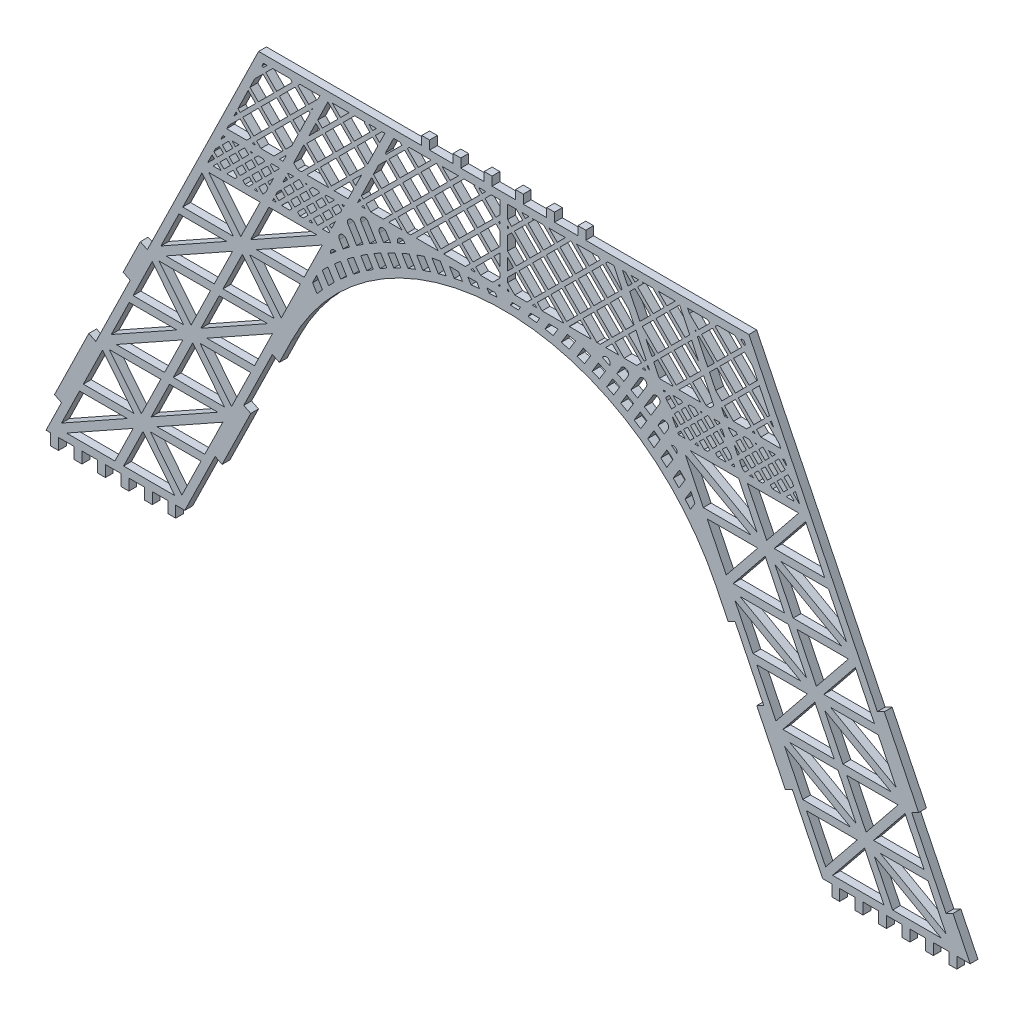
from build123d import *

# Parameters (mm, degrees)
BOSS_EXTRUDE1_DEPTH = 3


with BuildPart() as part:
    # Sketch1 → Boss-Extrude1 (new body)
    with BuildSketch(Plane.XY):
        with BuildLine():
            Line((89.934803369, 195.474198664), (92.629395714, 194.155421921))
            Line((92.629395714, 194.155421921), (97.353202661, 203.807346789))
            ThreePointArc((97.353202661, 203.807346789), (178.815734464, 254.633848748), (260.278266268, 203.807346789))
            Line((260.278266268, 203.807346789), (265.002073215, 194.155421922))
            Line((265.002073215, 194.155421922), (267.696665559, 195.474198664))
            Line((267.696665559, 195.474198664), (278.686471747, 173.019262459))
            Line((278.686471747, 173.019262459), (275.991879402, 171.700485717))
            Line((275.991879402, 171.700485717), (286.98168559, 149.245549512))
            Line((286.98168559, 149.245549512), (289.676277934, 150.564326255))
            Line((289.676277934, 150.564326255), (301.311514626, 126.790613307))
            Line((301.311514626, 126.790613307), (304.815734464, 126.790613307))
            Line((304.815734464, 126.790613307), (304.815734464, 122.449462056))
            Line((304.815734464, 122.449462056), (307.815734464, 122.449462056))
            Line((307.815734464, 122.449462056), (307.815734464, 126.790613307))
            Line((307.815734464, 126.790613307), (313.815734464, 126.790613307))
            Line((313.815734464, 126.790613307), (313.815734464, 122.449462056))
            Line((313.815734464, 122.449462056), (316.815734464, 122.449462056))
            Line((316.815734464, 122.449462056), (316.815734464, 126.790613307))
            Line((316.815734464, 126.790613307), (322.815734464, 126.790613307))
            Line((322.815734464, 126.790613307), (322.815734464, 122.449462057))
            Line((322.815734464, 122.449462057), (325.815734464, 122.449462057))
            Line((325.815734464, 122.449462057), (325.815734464, 126.790613307))
            Line((325.815734464, 126.790613307), (331.815734464, 126.790613307))
            Line((331.815734464, 126.790613307), (331.815734464, 122.449462057))
            Line((331.815734464, 122.449462057), (334.815734464, 122.449462057))
            Line((334.815734464, 122.449462057), (334.815734464, 126.790613307))
            Line((334.815734464, 126.790613307), (340.815734464, 126.790613307))
            Line((340.815734464, 126.790613307), (340.815734464, 122.449462057))
            Line((340.815734464, 122.449462057), (343.815734464, 122.449462057))
            Line((343.815734464, 122.449462057), (343.815734464, 126.790613307))
            Line((343.815734464, 126.790613307), (349.815734464, 126.790613307))
            Line((349.815734464, 126.790613307), (349.815734464, 122.449462057))
            Line((349.815734464, 122.449462057), (352.815734464, 122.449462057))
            Line((352.815734464, 122.449462057), (352.815734464, 126.790613307))
            Line((352.815734464, 126.790613307), (357.971491777, 126.790613307))
            Line((357.971491777, 126.790613307), (351.377608065, 140.26357503))
            Line((351.377608065, 140.26357503), (348.68301572, 138.944798288))
            Line((348.68301572, 138.944798288), (335.495248295, 165.890721733))
            Line((335.495248295, 165.890721733), (338.18984064, 167.209498476))
            Line((338.18984064, 167.209498476), (325.002073215, 194.155421921))
            Line((325.002073215, 194.155421921), (322.30748087, 192.836645179))
            Line((322.30748087, 192.836645179), (272.975711615, 293.633848749))
            Line((272.975711615, 293.633848749), (210.315734464, 293.633848749))
            Line((210.315734464, 293.633848749), (210.315734464, 297))
            Line((210.315734464, 297), (207.315734464, 297))
            Line((207.315734464, 297), (207.315734464, 293.633848749))
            Line((207.315734464, 293.633848749), (198.315734464, 293.633848749))
            Line((198.315734464, 293.633848749), (198.315734464, 297))
            Line((198.315734464, 297), (195.315734464, 297))
            Line((195.315734464, 297), (195.315734464, 293.633848749))
            Line((195.315734464, 293.633848749), (186.315734464, 293.633848749))
            Line((186.315734464, 293.633848749), (186.315734464, 297))
            Line((186.315734464, 297), (183.315734464, 297))
            Line((183.315734464, 297), (183.315734464, 293.633848749))
            Line((183.315734464, 293.633848749), (174.315734464, 293.633848749))
            Line((174.315734464, 293.633848749), (174.315734464, 297))
            Line((174.315734464, 297), (171.315734464, 297))
            Line((171.315734464, 297), (171.315734464, 293.633848749))
            Line((171.315734464, 293.633848749), (162.315734464, 293.633848749))
            Line((162.315734464, 293.633848749), (162.315734464, 297))
            Line((162.315734464, 297), (159.315734464, 297))
            Line((159.315734464, 297), (159.315734464, 293.633848749))
            Line((159.315734464, 293.633848749), (150.315734464, 293.633848749))
            Line((150.315734464, 293.633848749), (150.315734464, 297))
            Line((150.315734464, 297), (147.315734464, 297))
            Line((147.315734464, 297), (147.315734464, 293.633848749))
            Line((147.315734464, 293.633848749), (84.655757313, 293.633848749))
            Line((84.655757313, 293.633848749), (41.917871771, 206.309606902))
            Line((41.917871771, 206.309606902), (39.223279426, 207.628383644))
            Line((39.223279426, 207.628383644), (32.629395714, 194.155421921))
            Line((32.629395714, 194.155421921), (35.323988058, 192.836645179))
            Line((35.323988058, 192.836645179), (22.136220633, 165.890721733))
            Line((22.136220633, 165.890721733), (19.441628289, 167.209498476))
            Line((19.441628289, 167.209498476), (6.253860864, 140.26357503))
            Line((6.253860864, 140.26357503), (8.948453208, 138.944798288))
            Line((8.948453208, 138.944798288), (3, 126.790613307))
            Line((3, 126.790613307), (4.815734464, 126.790613307))
            Line((4.815734464, 126.790613307), (4.815734464, 122.449462056))
            Line((4.815734464, 122.449462056), (7.815734464, 122.449462056))
            Line((7.815734464, 122.449462056), (7.815734464, 126.790613307))
            Line((7.815734464, 126.790613307), (13.815734464, 126.790613307))
            Line((13.815734464, 126.790613307), (13.815734464, 122.449462056))
            Line((13.815734464, 122.449462056), (16.815734464, 122.449462056))
            Line((16.815734464, 122.449462056), (16.815734464, 126.790613307))
            Line((16.815734464, 126.790613307), (22.815734464, 126.790613307))
            Line((22.815734464, 126.790613307), (22.815734464, 122.449462057))
            Line((22.815734464, 122.449462057), (25.815734464, 122.449462057))
            Line((25.815734464, 122.449462057), (25.815734464, 126.790613307))
            Line((25.815734464, 126.790613307), (31.815734464, 126.790613307))
            Line((31.815734464, 126.790613307), (31.815734464, 122.449462057))
            Line((31.815734464, 122.449462057), (34.815734464, 122.449462057))
            Line((34.815734464, 122.449462057), (34.815734464, 126.790613307))
            Line((34.815734464, 126.790613307), (40.815734464, 126.790613307))
            Line((40.815734464, 126.790613307), (40.815734464, 122.449462056))
            Line((40.815734464, 122.449462056), (43.815734464, 122.449462056))
            Line((43.815734464, 122.449462056), (43.815734464, 126.790613307))
            Line((43.815734464, 126.790613307), (49.815734464, 126.790613307))
            Line((49.815734464, 126.790613307), (49.815734464, 122.449462056))
            Line((49.815734464, 122.449462056), (52.815734464, 122.449462056))
            Line((52.815734464, 122.449462056), (52.815734464, 126.790613307))
            Line((52.815734464, 126.790613307), (56.319954302, 126.790613307))
            Line((56.319954302, 126.790613307), (67.955190994, 150.564326254))
            Line((67.955190994, 150.564326254), (70.649783339, 149.245549512))
            Line((70.649783339, 149.245549512), (81.639589526, 171.700485717))
            Line((81.639589526, 171.700485717), (78.944997182, 173.019262459))
            Line((78.944997182, 173.019262459), (89.934803369, 195.474198664))
        make_face()
        Polygon((29.458213877, 129.790613307), (10.877270476, 129.790613307), (36.477464972, 144.132707502), align=None, mode=Mode.SUBTRACT)
        Polygon((34.191261131, 146.290613307), (8.967635057, 132.159485469), (15.88363583, 146.290613307), align=None, mode=Mode.SUBTRACT)
        Polygon((40.249009391, 145.014414528), (52.521478324, 129.790613307), (32.798236726, 129.790613307), align=None, mode=Mode.SUBTRACT)
        Polygon((62.523544434, 146.290613307), (55.176022091, 131.277778444), (43.073620937, 146.290613307), align=None, mode=Mode.SUBTRACT)
        Polygon((17.351883981, 149.290613307), (24.699406324, 164.303448171), (36.801807479, 149.290613307), align=None, mode=Mode.SUBTRACT)
        Polygon((39.626419025, 150.566812087), (27.353950091, 165.790613307), (47.077191689, 165.790613307), align=None, mode=Mode.SUBTRACT)
        Polygon((70.907793358, 163.421741145), (63.991792585, 149.290613307), (45.684167284, 149.290613307), align=None, mode=Mode.SUBTRACT)
        Polygon((43.397963444, 151.448519112), (50.417214538, 165.790613307), (68.998157939, 165.790613307), align=None, mode=Mode.SUBTRACT)
        Polygon((55.564690934, 183.132707502), (48.54543984, 168.790613307), (29.964496439, 168.790613307), align=None, mode=Mode.SUBTRACT)
        Polygon((28.05486102, 171.159485469), (34.970861793, 185.290613307), (53.278487094, 185.290613307), align=None, mode=Mode.SUBTRACT)
        Polygon((59.336235353, 184.014414528), (71.608704287, 168.790613307), (51.885462689, 168.790613307), align=None, mode=Mode.SUBTRACT)
        Polygon((81.610770397, 185.290613307), (74.263248054, 170.277778444), (62.160846899, 185.290613307), align=None, mode=Mode.SUBTRACT)
        Polygon((36.439109944, 188.290613307), (43.786632287, 203.303448171), (55.889033441, 188.290613307), align=None, mode=Mode.SUBTRACT)
        Polygon((58.713644987, 189.566812087), (46.441176054, 204.790613307), (66.164417652, 204.790613307), align=None, mode=Mode.SUBTRACT)
        Polygon((89.995019321, 202.421741145), (83.079018548, 188.290613307), (64.771393247, 188.290613307), align=None, mode=Mode.SUBTRACT)
        Polygon((62.485189406, 190.448519112), (69.504440501, 204.790613307), (88.085383902, 204.790613307), align=None, mode=Mode.SUBTRACT)
        Polygon((295.107924494, 146.290613307), (314.557847992, 146.290613307), (302.455446837, 131.277778444), align=None, mode=Mode.SUBTRACT)
        Polygon((305.109990604, 129.790613307), (317.382459537, 145.014414528), (324.833232202, 129.790613307), align=None, mode=Mode.SUBTRACT)
        Polygon((328.173255051, 129.790613307), (321.154003957, 144.132707502), (346.754198452, 129.790613307), align=None, mode=Mode.SUBTRACT)
        Polygon((348.663833871, 132.159485469), (323.440207797, 146.290613307), (341.747833098, 146.290613307), align=None, mode=Mode.SUBTRACT)
        Polygon((311.947301644, 149.290613307), (293.639676343, 149.290613307), (286.72367557, 163.421741145), align=None, mode=Mode.SUBTRACT)
        Polygon((288.633310989, 165.790613307), (307.21425439, 165.790613307), (314.233505484, 151.448519112), align=None, mode=Mode.SUBTRACT)
        Polygon((310.554277239, 165.790613307), (330.277518837, 165.790613307), (318.005049904, 150.566812087), align=None, mode=Mode.SUBTRACT)
        Polygon((340.279584947, 149.290613307), (320.829661449, 149.290613307), (332.932062604, 164.303448171), align=None, mode=Mode.SUBTRACT)
        Polygon((305.746006239, 168.790613307), (286.022764641, 168.790613307), (298.295233575, 184.014414528), align=None, mode=Mode.SUBTRACT)
        Polygon((276.020698532, 185.290613307), (295.470622029, 185.290613307), (283.368220875, 170.277778444), align=None, mode=Mode.SUBTRACT)
        Polygon((327.666972489, 168.790613307), (309.086029088, 168.790613307), (302.066777994, 183.132707502), align=None, mode=Mode.SUBTRACT)
        Polygon((304.352981834, 185.290613307), (322.660607135, 185.290613307), (329.576607908, 171.159485469), align=None, mode=Mode.SUBTRACT)
        Polygon((292.860075681, 188.290613307), (274.552450381, 188.290613307), (267.636449608, 202.421741145), align=None, mode=Mode.SUBTRACT)
        Polygon((269.546085026, 204.790613307), (288.127028427, 204.790613307), (295.146279522, 190.448519112), align=None, mode=Mode.SUBTRACT)
        Polygon((291.467051277, 204.790613307), (311.190292875, 204.790613307), (298.917823941, 189.566812087), align=None, mode=Mode.SUBTRACT)
        Polygon((321.192358984, 188.290613307), (301.742435487, 188.290613307), (313.844836641, 203.303448171), align=None, mode=Mode.SUBTRACT)
        Polygon((74.651916897, 222.132707502), (67.632665803, 207.790613307), (49.051722401, 207.790613307), align=None, mode=Mode.SUBTRACT)
        Polygon((47.142086983, 210.159485469), (54.058087756, 224.290613307), (72.365713056, 224.290613307), align=None, mode=Mode.SUBTRACT)
        Polygon((78.423461316, 223.014414528), (90.69593025, 207.790613307), (70.972688652, 207.790613307), align=None, mode=Mode.SUBTRACT)
        Polygon((100.697996359, 224.290613307), (93.350474016, 209.277778444), (81.248072862, 224.290613307), align=None, mode=Mode.SUBTRACT)
        Polygon((55.526335907, 227.290613307), (62.87385825, 242.303448171), (74.976259404, 227.290613307), align=None, mode=Mode.SUBTRACT)
        Polygon((65.528402016, 243.790613307), (85.251643614, 243.790613307), (77.80087095, 228.566812087), align=None, mode=Mode.SUBTRACT)
        Polygon((68.75560906, 248.354953136), (70.319948888, 246.790613307), (67.191269232, 246.790613307), align=None, mode=Mode.SUBTRACT)
        Polygon((65.069948888, 246.790613307), (66.795077514, 250.315484681), (67.694948888, 249.415613307), align=None, mode=Mode.SUBTRACT)
        Polygon((68.75560906, 250.476273479), (67.492134742, 251.739747797), (68.068919069, 252.918263145), (69.642307011, 254.491651087), (71.206646839, 252.927311258), align=None, mode=Mode.SUBTRACT)
        Polygon((83.654004962, 247.503349038), (84.366740693, 246.790613307), (82.941269232, 246.790613307), align=None, mode=Mode.SUBTRACT)
        Polygon((90.497020142, 247.683729761), (91.355042742, 246.825707161), (91.319948888, 246.790613307), (90.059914614, 246.790613307), align=None, mode=Mode.SUBTRACT)
        Polygon((72.441269232, 246.790613307), (74.892307011, 249.241651087), (76.456646839, 247.677311258), (75.569948888, 246.790613307), align=None, mode=Mode.SUBTRACT)
        Polygon((71.38060906, 247.851273479), (69.816269232, 249.415613307), (72.267307011, 251.866651087), (73.831646839, 250.302311258), align=None, mode=Mode.SUBTRACT)
        Polygon((79.464665134, 246.790613307), (78.577967183, 247.677311258), (81.029004962, 250.128349038), (82.59334479, 248.56400921), (80.819948888, 246.790613307), align=None, mode=Mode.SUBTRACT)
        Polygon((77.517307011, 248.73797143), (75.952967183, 250.302311258), (78.404004962, 252.753349038), (79.96834479, 251.18900921), align=None, mode=Mode.SUBTRACT)
        Polygon((86.279004962, 246.999669381), (84.714665134, 248.56400921), (87.165702913, 251.015046989), (88.254515202, 249.9262347), (87.342889171, 248.06355359), align=None, mode=Mode.SUBTRACT)
        Polygon((83.654004962, 249.624669381), (82.089665134, 251.18900921), (84.540702913, 253.640046989), (86.105042742, 252.075707161), align=None, mode=Mode.SUBTRACT)
        Polygon((88.951572431, 251.350497815), (88.226363085, 252.075707161), (90.341859352, 254.191203428), align=None, mode=Mode.SUBTRACT)
        Polygon((109.169942966, 226.614619747), (107.104403072, 224.240392777), (105.388978946, 227.0509636), (106.953063328, 230.246781108), align=None, mode=Mode.SUBTRACT)
        Polygon((109.082245283, 241.421741145), (102.16624451, 227.290613307), (83.85861921, 227.290613307), align=None, mode=Mode.SUBTRACT)
        Polygon((88.591666463, 243.790613307), (107.172609864, 243.790613307), (81.572415369, 229.448519112), align=None, mode=Mode.SUBTRACT)
        with BuildLine():
            Line((109.11442913, 233.085371436), (109.106891433, 233.097857388))
            ThreePointArc((109.106891433, 233.097857388), (110.141695024, 234.125502772), (111.191646446, 235.137666553))
            ThreePointArc((111.191646446, 235.137666553), (111.46182883, 234.921073967), (111.675144578, 234.648297025))
            Line((111.675144578, 234.648297025), (113.708387044, 231.317008942))
            ThreePointArc((113.708387044, 231.317008942), (112.607582632, 230.235643757), (111.524736089, 229.136296505))
            Line((111.524736089, 229.136296505), (109.11442913, 233.085371436))
        make_face(mode=Mode.SUBTRACT)
        with BuildLine():
            ThreePointArc((112.257210706, 240.164956683), (112.720613468, 241.746527752), (114.356307346, 241.94805865))
            ThreePointArc((114.356307346, 241.94805865), (113.30069248, 241.063649303), (112.257210706, 240.164956683))
        make_face(mode=Mode.SUBTRACT)
        with BuildLine():
            Line((116.190521688, 233.630047872), (113.807748433, 237.534011262))
            ThreePointArc((113.807748433, 237.534011262), (114.954307556, 238.531095025), (116.116157689, 239.510318248))
            Line((116.116157689, 239.510318248), (118.486470352, 235.626770436))
            ThreePointArc((118.486470352, 235.626770436), (117.330390096, 234.63772982), (116.190521688, 233.630047872))
        make_face(mode=Mode.SUBTRACT)
        with BuildLine():
            Line((121.090642361, 237.739861929), (118.731183869, 241.605626142))
            ThreePointArc((118.731183869, 241.605626142), (119.930062446, 242.518477894), (121.142807561, 243.412825395))
            Line((121.142807561, 243.412825395), (123.495033669, 239.558910804))
            ThreePointArc((123.495033669, 239.558910804), (122.285520793, 238.65905816), (121.090642361, 237.739861929))
        make_face(mode=Mode.SUBTRACT)
        Polygon((104.689098816, 247.538442892), (105.4369284, 246.790613307), (103.941269232, 246.790613307), align=None, mode=Mode.SUBTRACT)
        Polygon((111.95645783, 247.29447978), (111.709857491, 246.790613307), (109.191269232, 246.790613307), (110.825796767, 248.425140843), align=None, mode=Mode.SUBTRACT)
        Polygon((93.511456939, 246.790613307), (93.476363085, 246.825707161), (95.927400865, 249.27674494), (97.491740693, 247.712405112), (96.569948888, 246.790613307), align=None, mode=Mode.SUBTRACT)
        Polygon((92.415702913, 247.886367333), (91.19407737, 249.107992876), (91.851089294, 250.45043337), (93.302400865, 251.90174494), (94.866740693, 250.337405112), align=None, mode=Mode.SUBTRACT)
        Polygon((100.534852841, 246.790613307), (99.613061036, 247.712405112), (102.064098816, 250.163442891), (103.628438644, 248.599103063), (101.819948888, 246.790613307), align=None, mode=Mode.SUBTRACT)
        Polygon((98.552400865, 248.773065284), (96.988061036, 250.337405112), (99.439098816, 252.788442891), (101.003438644, 251.224103063), align=None, mode=Mode.SUBTRACT)
        Polygon((107.314098816, 247.034763235), (105.749758988, 248.599103063), (108.200796767, 251.050140843), (109.765136595, 249.485801014), align=None, mode=Mode.SUBTRACT)
        Polygon((114.124029577, 251.723373652), (112.653515059, 248.718742895), (111.886456939, 249.485801014), align=None, mode=Mode.SUBTRACT)
        Polygon((104.689098816, 249.659763235), (103.124758988, 251.224103063), (105.575796767, 253.675140843), (107.140136595, 252.110801014), align=None, mode=Mode.SUBTRACT)
        Polygon((110.825796767, 250.546461186), (109.261456939, 252.110801014), (111.712494718, 254.561838794), (113.276834546, 252.997498966), align=None, mode=Mode.SUBTRACT)
        with BuildLine():
            Line((118.269028291, 248.121258748), (119.575045889, 245.981464337))
            ThreePointArc((119.575045889, 245.981464337), (118.36030564, 245.090509862), (117.158962841, 244.181571344))
            Line((117.158962841, 244.181571344), (115.708312843, 246.558333159))
            ThreePointArc((115.708312843, 246.558333159), (116.207207772, 248.620153677), (118.269028291, 248.121258748))
        make_face(mode=Mode.SUBTRACT)
        with BuildLine():
            Line((126.217922511, 241.477495259), (123.870949894, 245.322802469))
            ThreePointArc((123.870949894, 245.322802469), (125.121148086, 246.153006395), (126.383888087, 246.964006868))
            Line((126.383888087, 246.964006868), (128.728563185, 243.122463939))
            ThreePointArc((128.728563185, 243.122463939), (127.466655351, 242.310033796), (126.217922511, 241.477495259))
        make_face(mode=Mode.SUBTRACT)
        with BuildLine():
            Line((131.289278633, 244.685389528), (128.944603534, 248.526932457))
            ThreePointArc((128.944603534, 248.526932457), (130.243177174, 249.279222679), (131.553096237, 250.011579236))
            Line((131.553096237, 250.011579236), (133.900068854, 246.166272026))
            ThreePointArc((133.900068854, 246.166272026), (132.588743351, 245.436286037), (131.289278633, 244.685389528))
        make_face(mode=Mode.SUBTRACT)
        with BuildLine():
            Line((121.565970147, 254.857739609), (124.820785523, 249.525012273))
            ThreePointArc((124.820785523, 249.525012273), (123.557531244, 248.714893729), (122.306429365, 247.886131086))
            Line((122.306429365, 247.886131086), (119.005254699, 253.29481402))
            ThreePointArc((119.005254699, 253.29481402), (119.504149629, 255.356634539), (121.565970147, 254.857739609))
        make_face(mode=Mode.SUBTRACT)
        with BuildLine():
            Line((136.576921314, 247.57285624), (134.225299166, 251.425781295))
            ThreePointArc((134.225299166, 251.425781295), (135.572646249, 252.099524997), (136.930170337, 252.752520472))
            Line((136.930170337, 252.752520472), (139.288781012, 248.888145333))
            ThreePointArc((139.288781012, 248.888145333), (137.92756205, 248.241405866), (136.576921314, 247.57285624))
        make_face(mode=Mode.SUBTRACT)
        with BuildLine():
            Line((142.068094645, 250.126855969), (139.700010033, 254.006753317))
            ThreePointArc((139.700010033, 254.006753317), (141.09695852, 254.600641099), (142.502920391, 255.17286395))
            Line((142.502920391, 255.17286395), (144.882940562, 251.273411243))
            ThreePointArc((144.882940562, 251.273411243), (143.470868147, 250.711548237), (142.068094645, 250.126855969))
        make_face(mode=Mode.SUBTRACT)
        Polygon((72.267307011, 253.98797143), (70.702967183, 255.552311258), (73.154004962, 258.003349038), (74.71834479, 256.43900921), align=None, mode=Mode.SUBTRACT)
        Polygon((74.892307011, 251.36297143), (73.327967183, 252.927311258), (75.779004962, 255.378349038), (77.34334479, 253.81400921), align=None, mode=Mode.SUBTRACT)
        Polygon((71.819948888, 258.790613307), (70.102293257, 257.072957677), (70.942941492, 258.790613307), align=None, mode=Mode.SUBTRACT)
        Polygon((78.404004962, 254.874669381), (76.839665134, 256.43900921), (79.191269232, 258.790613307), (79.390136595, 258.790613307), (80.855042742, 257.325707161), align=None, mode=Mode.SUBTRACT)
        Polygon((75.779004962, 257.499669381), (74.488061036, 258.790613307), (77.069948888, 258.790613307), align=None, mode=Mode.SUBTRACT)
        Polygon((81.029004962, 252.249669381), (79.464665134, 253.81400921), (81.915702913, 256.265046989), (83.480042742, 254.700707161), align=None, mode=Mode.SUBTRACT)
        Polygon((87.165702913, 253.136367333), (85.601363085, 254.700707161), (88.052400865, 257.15174494), (89.616740693, 255.587405112), align=None, mode=Mode.SUBTRACT)
        Polygon((84.540702913, 255.761367333), (82.976363085, 257.325707161), (84.441269232, 258.790613307), (86.413532498, 258.790613307), (86.991740693, 258.212405112), align=None, mode=Mode.SUBTRACT)
        Polygon((81.915702913, 258.386367333), (81.511456939, 258.790613307), (82.319948888, 258.790613307), align=None, mode=Mode.SUBTRACT)
        Polygon((90.677400865, 256.648065284), (89.113061036, 258.212405112), (89.691269232, 258.790613307), (92.592884369, 258.790613307), (92.37523354, 258.345897959), align=None, mode=Mode.SUBTRACT)
        Polygon((82.802400865, 262.40174494), (83.413532498, 261.790613307), (82.191269232, 261.790613307), align=None, mode=Mode.SUBTRACT)
        Polygon((77.552400865, 267.65174494), (81.741740693, 263.462405112), (80.069948888, 261.790613307), (72.411189643, 261.790613307), (73.101263439, 263.200607514), align=None, mode=Mode.SUBTRACT)
        Polygon((75.134637627, 267.355302046), (76.026514711, 269.177631093), (76.491740693, 268.712405112), align=None, mode=Mode.SUBTRACT)
        Polygon((83.863061036, 263.462405112), (89.825796767, 269.425140843), (94.015136595, 265.235801014), (90.569948888, 261.790613307), (85.534852841, 261.790613307), align=None, mode=Mode.SUBTRACT)
        Polygon((82.802400865, 264.523065284), (78.613061036, 268.712405112), (84.575796767, 274.675140843), (88.765136595, 270.485801014), align=None, mode=Mode.SUBTRACT)
        Polygon((77.552400865, 269.773065284), (76.72357194, 270.601894209), (80.64223331, 278.608704299), (83.515136595, 275.735801014), align=None, mode=Mode.SUBTRACT)
        Polygon((89.825796767, 271.546461186), (85.636456939, 275.735801014), (91.599192669, 281.698536745), (95.788532498, 277.509196917), align=None, mode=Mode.SUBTRACT)
        Polygon((84.575796767, 276.796461186), (81.339290539, 280.032967415), (83.165952177, 283.765296253), (86.349192669, 286.948536745), (90.538532498, 282.759196917), align=None, mode=Mode.SUBTRACT)
        Polygon((85.199326365, 287.919990784), (85.257951909, 288.039777505), (85.288532498, 288.009196917), align=None, mode=Mode.SUBTRACT)
        Polygon((86.349192669, 289.069857089), (85.955009137, 289.46404062), (86.527532011, 290.633848749), (87.91318433, 290.633848749), align=None, mode=Mode.SUBTRACT)
        Polygon((95.927400865, 251.398065284), (94.363061036, 252.962405112), (96.814098816, 255.413442891), (98.378438644, 253.849103063), align=None, mode=Mode.SUBTRACT)
        Polygon((95.11273874, 257.114802967), (95.753438644, 256.474103063), (93.884463482, 254.605127901), align=None, mode=Mode.SUBTRACT)
        Polygon((102.064098816, 252.284763235), (100.499758988, 253.849103063), (102.950796767, 256.300140843), (104.515136595, 254.735801014), align=None, mode=Mode.SUBTRACT)
        Polygon((96.814098816, 257.534763235), (95.809795969, 258.539066082), (95.932907218, 258.790613307), (98.069948888, 258.790613307), align=None, mode=Mode.SUBTRACT)
        Polygon((99.439098816, 254.909763235), (97.874758988, 256.474103063), (100.191269232, 258.790613307), (100.460324302, 258.790613307), (101.890136595, 257.360801014), align=None, mode=Mode.SUBTRACT)
        Polygon((108.200796767, 253.171461186), (106.636456939, 254.735801014), (109.087494718, 257.186838794), (110.651834546, 255.622498966), align=None, mode=Mode.SUBTRACT)
        Polygon((105.575796767, 255.796461186), (104.011456939, 257.360801014), (105.441269232, 258.790613307), (107.483720205, 258.790613307), (108.026834546, 258.247498966), align=None, mode=Mode.SUBTRACT)
        Polygon((102.950796767, 258.421461186), (102.581644646, 258.790613307), (103.319948888, 258.790613307), align=None, mode=Mode.SUBTRACT)
        Polygon((111.712494718, 256.683159137), (110.14815489, 258.247498966), (110.691269232, 258.790613307), (113.819948888, 258.790613307), align=None, mode=Mode.SUBTRACT)
        Polygon((95.075796767, 264.175140843), (95.178093101, 264.072844509), (94.06113252, 261.790613307), (92.691269232, 261.790613307), align=None, mode=Mode.SUBTRACT)
        Polygon((97.42059804, 261.83033957), (97.460324302, 261.790613307), (97.401155369, 261.790613307), align=None, mode=Mode.SUBTRACT)
        Polygon((107.349192669, 265.948536745), (111.507116107, 261.790613307), (103.191269232, 261.790613307), align=None, mode=Mode.SUBTRACT)
        Polygon((114.337494718, 254.058159137), (112.77315489, 255.622498966), (115.224192669, 258.073536745), (116.572176429, 256.725552986), (116.157403765, 255.878068184), align=None, mode=Mode.SUBTRACT)
        Polygon((116.628436451, 258.790613307), (117.582850095, 258.790613307), (117.269233657, 258.149816101), align=None, mode=Mode.SUBTRACT)
        with BuildLine():
            Line((126.633394275, 258.072076102), (129.988575708, 252.574907852))
            ThreePointArc((129.988575708, 252.574907852), (128.679525354, 251.841088663), (127.381500971, 251.087937862))
            Line((127.381500971, 251.087937862), (124.072678828, 256.509150513))
            ThreePointArc((124.072678828, 256.509150513), (124.571573757, 258.570971031), (126.633394275, 258.072076102))
        make_face(mode=Mode.SUBTRACT)
        with BuildLine():
            Line((133.683394275, 258.072076102), (135.358471898, 255.327609458))
            ThreePointArc((135.358471898, 255.327609458), (134.003228285, 254.670757666), (132.657910025, 253.993809878))
            Line((132.657910025, 253.993809878), (131.122678828, 256.509150513))
            ThreePointArc((131.122678828, 256.509150513), (131.621573757, 258.570971031), (133.683394275, 258.072076102))
        make_face(mode=Mode.SUBTRACT)
        Polygon((124.896150865, 262.49549494), (125.601032498, 261.790613307), (124.191269232, 261.790613307), align=None, mode=Mode.SUBTRACT)
        Polygon((123.835490693, 263.556155112), (122.698978076, 262.419642496), (123.445884914, 263.945760891), align=None, mode=Mode.SUBTRACT)
        Polygon((98.117655268, 263.254602685), (101.915778033, 271.015122109), (102.099192669, 271.198536745), (106.288532498, 267.009196917), (101.069948888, 261.790613307), (99.581644646, 261.790613307), align=None, mode=Mode.SUBTRACT)
        Polygon((114.396150865, 272.99549494), (118.585490693, 268.806155112), (112.599192669, 262.819857089), (108.409852841, 267.009196917), align=None, mode=Mode.SUBTRACT)
        Polygon((95.075796767, 266.296461186), (90.886456939, 270.485801014), (96.849192669, 276.448536745), (99.793811699, 273.503917715), (97.407577909, 268.628242328), align=None, mode=Mode.SUBTRACT)
        Polygon((109.146150865, 278.24549494), (113.335490693, 274.056155112), (107.349192669, 268.069857089), (103.159852841, 272.259196917), align=None, mode=Mode.SUBTRACT)
        Polygon((121.203379975, 266.18826583), (119.051098246, 261.790613307), (113.691269232, 261.790613307), (119.646150865, 267.74549494), align=None, mode=Mode.SUBTRACT)
        Polygon((125.956811036, 263.556155112), (131.919546767, 269.518890843), (136.108886595, 265.329551014), (132.569948888, 261.790613307), (127.722352841, 261.790613307), align=None, mode=Mode.SUBTRACT)
        Polygon((124.142942142, 265.370024006), (128.061603513, 273.376834097), (130.858886595, 270.579551014), (124.896150865, 264.616815284), align=None, mode=Mode.SUBTRACT)
        Polygon((120.706811036, 268.806155112), (124.188718315, 272.288062391), (121.900437203, 267.612528945), align=None, mode=Mode.SUBTRACT)
        Polygon((121.419546767, 280.018890843), (125.608886595, 275.829551014), (119.646150865, 269.866815284), (115.456811036, 274.056155112), align=None, mode=Mode.SUBTRACT)
        with BuildLine():
            Line((140.733394275, 258.072076102), (140.918038332, 257.769553134))
            ThreePointArc((140.918038332, 257.769553134), (139.517269529, 257.191557949), (138.125312599, 256.59265263))
            ThreePointArc((138.125312599, 256.59265263), (138.712945785, 258.595322339), (140.733394275, 258.072076102))
        make_face(mode=Mode.SUBTRACT)
        with BuildLine():
            Line((147.767334526, 252.339957046), (145.372662351, 256.263415765))
            ThreePointArc((145.372662351, 256.263415765), (146.82066273, 256.775153855), (148.276489293, 257.264183495))
            Line((148.276489293, 257.264183495), (150.688500556, 253.31231621))
            ThreePointArc((150.688500556, 253.31231621), (149.22392342, 252.838135785), (147.767334526, 252.339957046))
        make_face(mode=Mode.SUBTRACT)
        with BuildLine():
            Line((153.682120069, 254.199905604), (151.249701348, 258.185208703))
            Line((151.249701348, 258.185208703), (154.39483708, 258.790613307))
            Line((154.39483708, 258.790613307), (156.71458721, 254.989907735))
            ThreePointArc((156.71458721, 254.989907735), (155.195050671, 254.607585298), (153.682120069, 254.199905604))
        make_face(mode=Mode.SUBTRACT)
        Polygon((137.169546767, 264.268890843), (139.647824302, 261.790613307), (134.691269232, 261.790613307), align=None, mode=Mode.SUBTRACT)
        Polygon((153.632282498, 261.852946917), (153.569948888, 261.790613307), (145.191269232, 261.790613307), (149.442942669, 266.042286745), align=None, mode=Mode.SUBTRACT)
        with BuildLine():
            Line((159.823400898, 255.688761653), (157.930194323, 258.790613307))
            Line((157.930194323, 258.790613307), (161.44483708, 258.790613307))
            Line((161.44483708, 258.790613307), (162.974171538, 256.284933959))
            ThreePointArc((162.974171538, 256.284933959), (161.396235574, 256.000327957), (159.823400898, 255.688761653))
        make_face(mode=Mode.SUBTRACT)
        with BuildLine():
            Line((166.24042025, 256.786118327), (165.016982285, 258.790613307))
            Line((165.016982285, 258.790613307), (168.49483708, 258.790613307))
            Line((168.49483708, 258.790613307), (169.485133104, 257.168100793))
            ThreePointArc((169.485133104, 257.168100793), (167.861111607, 256.991253333), (166.24042025, 256.786118327))
        make_face(mode=Mode.SUBTRACT)
        with BuildLine():
            Line((173.213349568, 257.466205712), (172.405001057, 258.790613307))
            Line((172.405001057, 258.790613307), (175.54483708, 258.790613307))
            Line((175.54483708, 258.790613307), (176.27194511, 257.59931106))
            ThreePointArc((176.27194511, 257.59931106), (174.742103653, 257.54525162), (173.213349568, 257.466205712))
        make_face(mode=Mode.SUBTRACT)
        Polygon((166.989900865, 262.58924494), (167.788532498, 261.790613307), (166.191269232, 261.790613307), align=None, mode=Mode.SUBTRACT)
        Polygon((177.315734464, 262.41507854), (177.315734464, 261.790613307), (176.691269232, 261.790613307), align=None, mode=Mode.SUBTRACT)
        Polygon((138.230206939, 265.329551014), (144.192942669, 271.292286745), (148.382282498, 267.102946917), (143.069948888, 261.790613307), (141.769144646, 261.790613307), align=None, mode=Mode.SUBTRACT)
        Polygon((156.489900865, 273.08924494), (160.679240693, 268.899905112), (154.692942669, 262.913607089), (150.503602841, 267.102946917), align=None, mode=Mode.SUBTRACT)
        Polygon((132.980206939, 270.579551014), (138.942942669, 276.542286745), (143.132282498, 272.352946917), (137.169546767, 266.390211186), align=None, mode=Mode.SUBTRACT)
        Polygon((151.239900865, 278.33924494), (155.429240693, 274.149905112), (149.442942669, 268.163607089), (145.253602841, 272.352946917), align=None, mode=Mode.SUBTRACT)
        Polygon((165.929240693, 263.649905112), (164.069948888, 261.790613307), (155.815936451, 261.790613307), (155.753602841, 261.852946917), (161.739900865, 267.83924494), align=None, mode=Mode.SUBTRACT)
        Polygon((177.315734464, 266.310203146), (177.315734464, 264.536398883), (174.569948888, 261.790613307), (169.909852841, 261.790613307), (168.050561036, 263.649905112), (174.013296767, 269.612640843), align=None, mode=Mode.SUBTRACT)
        Polygon((162.800561036, 268.899905112), (168.763296767, 274.862640843), (172.952636595, 270.673301014), (166.989900865, 264.710565284), align=None, mode=Mode.SUBTRACT)
        Polygon((163.513296767, 280.112640843), (167.702636595, 275.923301014), (161.739900865, 269.960565284), (157.550561036, 274.149905112), align=None, mode=Mode.SUBTRACT)
        Polygon((177.315734464, 272.91507854), (177.315734464, 268.431523489), (175.073956939, 270.673301014), align=None, mode=Mode.SUBTRACT)
        Polygon((103.896150865, 283.49549494), (104.425015245, 282.96663056), (100.490868928, 274.92818083), (97.909852841, 277.509196917), align=None, mode=Mode.SUBTRACT)
        Polygon((106.667520184, 280.724125621), (108.085490693, 279.306155112), (103.949152221, 275.16981664), align=None, mode=Mode.SUBTRACT)
        Polygon((98.646150865, 288.74549494), (102.835490693, 284.556155112), (96.849192669, 278.569857089), (92.659852841, 282.759196917), align=None, mode=Mode.SUBTRACT)
        Polygon((105.122072474, 284.390893675), (104.956811036, 284.556155112), (105.43889246, 285.038236535), align=None, mode=Mode.SUBTRACT)
        Polygon((111.283238783, 290.155198827), (115.108886595, 286.329551014), (109.146150865, 280.366815284), (107.364577413, 282.148388736), align=None, mode=Mode.SUBTRACT)
        Polygon((116.169546767, 285.268890843), (120.358886595, 281.079551014), (114.396150865, 275.116815284), (110.206811036, 279.306155112), align=None, mode=Mode.SUBTRACT)
        Polygon((128.758660741, 274.801097212), (130.730292627, 278.829636703), (133.692942669, 281.792286745), (137.882282498, 277.602946917), (131.919546767, 271.640211186), align=None, mode=Mode.SUBTRACT)
        Polygon((122.480206939, 281.079551014), (128.442942669, 287.042286745), (130.434817172, 285.050412242), (126.516155802, 277.043602151), align=None, mode=Mode.SUBTRACT)
        Polygon((90.034504674, 290.633848749), (96.757797056, 290.633848749), (97.585490693, 289.806155112), (91.599192669, 283.819857089), (87.409852841, 288.009196917), align=None, mode=Mode.SUBTRACT)
        Polygon((103.896150865, 285.616815284), (99.706811036, 289.806155112), (100.534504674, 290.633848749), (108.177474889, 290.633848749), (107.472266648, 289.192931067), align=None, mode=Mode.SUBTRACT)
        Polygon((117.230206939, 286.329551014), (121.534504674, 290.633848749), (125.554513275, 290.633848749), (125.20294697, 290.282282444), (127.382282498, 288.102946917), (121.419546767, 282.140211186), align=None, mode=Mode.SUBTRACT)
        Polygon((116.169546767, 287.390211186), (112.925909204, 290.633848749), (119.41318433, 290.633848749), align=None, mode=Mode.SUBTRACT)
        Polygon((129.503602841, 288.102946917), (132.034504674, 290.633848749), (133.167440615, 290.633848749), (131.131874401, 286.474675357), align=None, mode=Mode.SUBTRACT)
        Polygon((126.972701009, 290.633848749), (129.91318433, 290.633848749), (128.442942669, 289.163607089), align=None, mode=Mode.SUBTRACT)
        Polygon((145.989900865, 283.58924494), (150.179240693, 279.399905112), (144.192942669, 273.413607089), (140.003602841, 277.602946917), align=None, mode=Mode.SUBTRACT)
        Polygon((158.263296767, 285.362640843), (162.452636595, 281.173301014), (156.489900865, 275.210565284), (152.300561036, 279.399905112), align=None, mode=Mode.SUBTRACT)
        Polygon((140.739900865, 288.83924494), (144.929240693, 284.649905112), (138.942942669, 278.663607089), (134.753602841, 282.852946917), align=None, mode=Mode.SUBTRACT)
        Polygon((153.013296767, 290.612640843), (157.202636595, 286.423301014), (151.239900865, 280.460565284), (147.050561036, 284.649905112), align=None, mode=Mode.SUBTRACT)
        Polygon((177.315734464, 280.35699495), (177.315734464, 275.036398883), (174.013296767, 271.733961186), (169.823956939, 275.923301014), (175.786692669, 281.886036745), align=None, mode=Mode.SUBTRACT)
        Polygon((164.573956939, 281.173301014), (170.536692669, 287.136036745), (174.726032498, 282.946696917), (168.763296767, 276.983961186), align=None, mode=Mode.SUBTRACT)
        Polygon((177.315734464, 283.41507854), (177.315734464, 282.478315294), (176.847352841, 282.946696917), align=None, mode=Mode.SUBTRACT)
        Polygon((136.507463464, 290.633848749), (138.945297056, 290.633848749), (139.679240693, 289.899905112), (133.692942669, 283.913607089), (133.37437934, 284.232170418), align=None, mode=Mode.SUBTRACT)
        Polygon((145.989900865, 285.710565284), (141.800561036, 289.899905112), (142.534504674, 290.633848749), (150.91318433, 290.633848749), align=None, mode=Mode.SUBTRACT)
        Polygon((158.263296767, 287.483961186), (155.113409204, 290.633848749), (161.41318433, 290.633848749), align=None, mode=Mode.SUBTRACT)
        Polygon((159.323956939, 286.423301014), (163.534504674, 290.633848749), (167.742013275, 290.633848749), (167.39044697, 290.282282444), (169.476032498, 288.196696917), (163.513296767, 282.233961186), align=None, mode=Mode.SUBTRACT)
        Polygon((174.034504673, 290.633848749), (177.315734464, 290.633848749), (177.315734464, 285.536398883), (175.786692669, 284.007357089), (171.597352841, 288.196696917), align=None, mode=Mode.SUBTRACT)
        Polygon((170.536692669, 289.257357089), (169.160201009, 290.633848749), (171.91318433, 290.633848749), align=None, mode=Mode.SUBTRACT)
        Polygon((276.383396066, 224.290613307), (264.280994912, 209.277778444), (256.933472569, 224.290613307), align=None, mode=Mode.SUBTRACT)
        Polygon((252.242489982, 227.0509636), (250.527065856, 224.240392777), (248.461525962, 226.614619747), (250.6784056, 230.246781108), align=None, mode=Mode.SUBTRACT)
        with BuildLine():
            ThreePointArc((220.701298591, 252.752520472), (222.058822679, 252.099524997), (223.406169762, 251.425781295))
            Line((223.406169762, 251.425781295), (221.054547614, 247.57285624))
            ThreePointArc((221.054547614, 247.57285624), (219.703906878, 248.241405866), (218.342687916, 248.888145333))
            Line((218.342687916, 248.888145333), (220.701298591, 252.752520472))
        make_face(mode=Mode.SUBTRACT)
        with BuildLine():
            ThreePointArc((215.128548537, 255.17286395), (216.534510408, 254.600641099), (217.931458895, 254.006753317))
            Line((217.931458895, 254.006753317), (215.563374283, 250.126855969))
            ThreePointArc((215.563374283, 250.126855969), (214.160600782, 250.711548237), (212.748528366, 251.273411243))
            Line((212.748528366, 251.273411243), (215.128548537, 255.17286395))
        make_face(mode=Mode.SUBTRACT)
        with BuildLine():
            Line((243.923081885, 231.317008942), (245.95632435, 234.648297025))
            ThreePointArc((245.95632435, 234.648297025), (246.169640098, 234.921073967), (246.439822482, 235.137666553))
            ThreePointArc((246.439822482, 235.137666553), (247.489773904, 234.125502772), (248.524577495, 233.097857388))
            Line((248.524577495, 233.097857388), (248.517039798, 233.085371436))
            Line((248.517039798, 233.085371436), (246.106732839, 229.136296505))
            ThreePointArc((246.106732839, 229.136296505), (245.023886296, 230.235643757), (243.923081885, 231.317008942))
        make_face(mode=Mode.SUBTRACT)
        with BuildLine():
            ThreePointArc((241.515311239, 239.510318248), (242.677161373, 238.531095025), (243.823720495, 237.534011262))
            Line((243.823720495, 237.534011262), (241.440947241, 233.630047872))
            ThreePointArc((241.440947241, 233.630047872), (240.301078832, 234.63772982), (239.144998577, 235.626770436))
            Line((239.144998577, 235.626770436), (241.515311239, 239.510318248))
        make_face(mode=Mode.SUBTRACT)
        with BuildLine():
            ThreePointArc((236.488661367, 243.412825395), (237.701406482, 242.518477894), (238.900285059, 241.605626142))
            Line((238.900285059, 241.605626142), (236.540826567, 237.739861929))
            ThreePointArc((236.540826567, 237.739861929), (235.345948135, 238.65905816), (234.136435259, 239.558910804))
            Line((234.136435259, 239.558910804), (236.488661367, 243.412825395))
        make_face(mode=Mode.SUBTRACT)
        with BuildLine():
            ThreePointArc((243.275161583, 241.94805865), (244.91085546, 241.746527752), (245.374258222, 240.164956683))
            ThreePointArc((245.374258222, 240.164956683), (244.330776448, 241.063649303), (243.275161583, 241.94805865))
        make_face(mode=Mode.SUBTRACT)
        Polygon((273.772849719, 227.290613307), (255.465224418, 227.290613307), (248.549223645, 241.421741145), align=None, mode=Mode.SUBTRACT)
        Polygon((269.039802465, 243.790613307), (276.059053559, 229.448519112), (250.458859064, 243.790613307), align=None, mode=Mode.SUBTRACT)
        with BuildLine():
            ThreePointArc((231.247580842, 246.964006868), (232.510320843, 246.153006395), (233.760519034, 245.322802469))
            Line((233.760519034, 245.322802469), (231.413546417, 241.477495259))
            ThreePointArc((231.413546417, 241.477495259), (230.164813578, 242.310033796), (228.902905743, 243.122463939))
            Line((228.902905743, 243.122463939), (231.247580842, 246.964006868))
        make_face(mode=Mode.SUBTRACT)
        with BuildLine():
            ThreePointArc((226.078372691, 250.011579236), (227.388291754, 249.279222679), (228.686865394, 248.526932457))
            Line((228.686865394, 248.526932457), (226.342190295, 244.685389528))
            ThreePointArc((226.342190295, 244.685389528), (225.042725577, 245.436286037), (223.731400074, 246.166272026))
            Line((223.731400074, 246.166272026), (226.078372691, 250.011579236))
        make_face(mode=Mode.SUBTRACT)
        with BuildLine():
            ThreePointArc((240.472506087, 244.181571344), (239.271163288, 245.090509862), (238.056423039, 245.981464337))
            Line((238.056423039, 245.981464337), (239.362440638, 248.121258748))
            ThreePointArc((239.362440638, 248.121258748), (241.424261156, 248.620153677), (241.923156085, 246.558333159))
            Line((241.923156085, 246.558333159), (240.472506087, 244.181571344))
        make_face(mode=Mode.SUBTRACT)
        with BuildLine():
            ThreePointArc((235.325039563, 247.886131086), (234.073937684, 248.714893729), (232.810683405, 249.525012273))
            Line((232.810683405, 249.525012273), (236.065498781, 254.857739609))
            ThreePointArc((236.065498781, 254.857739609), (238.1273193, 255.356634539), (238.626214229, 253.29481402))
            Line((238.626214229, 253.29481402), (235.325039563, 247.886131086))
        make_face(mode=Mode.SUBTRACT)
        Polygon((243.507439351, 251.723373652), (245.745011989, 249.485801014), (244.97795387, 248.718742895), align=None, mode=Mode.SUBTRACT)
        Polygon((245.91897421, 254.561838794), (248.370011989, 252.110801014), (246.805672161, 250.546461186), (244.354634382, 252.997498966), align=None, mode=Mode.SUBTRACT)
        Polygon((248.440199697, 246.790613307), (245.921611437, 246.790613307), (245.675011098, 247.294479779), (246.805672161, 248.425140843), align=None, mode=Mode.SUBTRACT)
        Polygon((253.690199697, 246.790613307), (252.194540528, 246.790613307), (252.942370112, 247.538442891), align=None, mode=Mode.SUBTRACT)
        Polygon((266.31152004, 246.790613307), (266.276426187, 246.825707161), (267.134448787, 247.683729761), (267.571554314, 246.790613307), align=None, mode=Mode.SUBTRACT)
        Polygon((249.430672161, 251.050140843), (251.881709941, 248.599103063), (250.317370112, 247.034763235), (247.866332333, 249.485801014), align=None, mode=Mode.SUBTRACT)
        Polygon((255.567370112, 250.163442891), (258.018407892, 247.712405112), (257.096616087, 246.790613307), (255.81152004, 246.790613307), (254.003030284, 248.599103063), align=None, mode=Mode.SUBTRACT)
        Polygon((252.055672161, 253.675140843), (254.506709941, 251.224103063), (252.942370112, 249.659763235), (250.491332333, 252.110801014), align=None, mode=Mode.SUBTRACT)
        Polygon((261.704068064, 249.27674494), (264.155105843, 246.825707161), (264.120011989, 246.790613307), (261.06152004, 246.790613307), (260.139728235, 247.712405112), align=None, mode=Mode.SUBTRACT)
        Polygon((265.780379634, 250.45043337), (266.437391558, 249.107992876), (265.215766015, 247.886367333), (262.764728235, 250.337405112), (264.329068064, 251.90174494), align=None, mode=Mode.SUBTRACT)
        Polygon((258.192370112, 252.788442891), (260.643407892, 250.337405112), (259.079068064, 248.773065284), (256.628030284, 251.224103063), align=None, mode=Mode.SUBTRACT)
        Polygon((267.289609576, 254.191203428), (269.405105843, 252.075707161), (268.679896497, 251.350497815), align=None, mode=Mode.SUBTRACT)
        Polygon((286.658780277, 207.790613307), (266.935538679, 207.790613307), (279.208007612, 223.014414528), align=None, mode=Mode.SUBTRACT)
        Polygon((308.579746527, 207.790613307), (289.998803126, 207.790613307), (282.979552031, 222.132707502), align=None, mode=Mode.SUBTRACT)
        Polygon((285.265755872, 224.290613307), (303.573381172, 224.290613307), (310.489381945, 210.159485469), align=None, mode=Mode.SUBTRACT)
        Polygon((292.103066912, 243.790613307), (279.830597978, 228.566812087), (272.379825314, 243.790613307), align=None, mode=Mode.SUBTRACT)
        Polygon((302.105133021, 227.290613307), (282.655209524, 227.290613307), (294.757610678, 242.303448171), align=None, mode=Mode.SUBTRACT)
        Polygon((274.690199697, 246.790613307), (273.264728235, 246.790613307), (273.977463966, 247.503349038), align=None, mode=Mode.SUBTRACT)
        Polygon((290.440199697, 246.790613307), (287.31152004, 246.790613307), (288.875859868, 248.354953135), align=None, mode=Mode.SUBTRACT)
        Polygon((270.465766015, 251.015046989), (272.916803794, 248.56400921), (271.352463966, 246.999669381), (270.288579758, 248.06355359), (269.376953726, 249.9262347), align=None, mode=Mode.SUBTRACT)
        Polygon((276.602463966, 250.128349038), (279.053501745, 247.677311258), (278.166803794, 246.790613307), (276.81152004, 246.790613307), (275.038124138, 248.56400921), align=None, mode=Mode.SUBTRACT)
        Polygon((273.090766015, 253.640046989), (275.541803794, 251.18900921), (273.977463966, 249.624669381), (271.526426187, 252.075707161), align=None, mode=Mode.SUBTRACT)
        Polygon((279.227463966, 252.753349038), (281.678501745, 250.302311258), (280.114161917, 248.73797143), (277.663124138, 251.18900921), align=None, mode=Mode.SUBTRACT)
        Polygon((281.174822089, 247.677311258), (282.739161917, 249.241651087), (285.190199697, 246.790613307), (282.06152004, 246.790613307), align=None, mode=Mode.SUBTRACT)
        Polygon((285.364161917, 251.866651087), (287.815199697, 249.415613307), (286.250859868, 247.851273479), (283.799822089, 250.302311258), align=None, mode=Mode.SUBTRACT)
        Polygon((292.56152004, 246.790613307), (289.93652004, 249.415613307), (290.836391414, 250.315484681), align=None, mode=Mode.SUBTRACT)
        Polygon((290.139334186, 251.739747796), (288.875859868, 250.476273479), (286.424822089, 252.927311258), (287.989161917, 254.491651087), (289.562549859, 252.918263145), align=None, mode=Mode.SUBTRACT)
        with BuildLine():
            Line((182.086631848, 258.790613307), (185.226467872, 258.790613307))
            Line((185.226467872, 258.790613307), (184.41811936, 257.466205712))
            ThreePointArc((184.41811936, 257.466205712), (182.889365275, 257.54525162), (181.359523818, 257.59931106))
            Line((181.359523818, 257.59931106), (182.086631848, 258.790613307))
        make_face(mode=Mode.SUBTRACT)
        with BuildLine():
            ThreePointArc((191.391048678, 256.786118327), (189.770357321, 256.991253333), (188.146335824, 257.168100793))
            Line((188.146335824, 257.168100793), (189.136631849, 258.790613307))
            Line((189.136631849, 258.790613307), (192.614486644, 258.790613307))
            Line((192.614486644, 258.790613307), (191.391048678, 256.786118327))
        make_face(mode=Mode.SUBTRACT)
        with BuildLine():
            Line((196.186631849, 258.790613307), (199.701274605, 258.790613307))
            Line((199.701274605, 258.790613307), (197.80806803, 255.688761653))
            ThreePointArc((197.80806803, 255.688761653), (196.235233354, 256.000327957), (194.657297391, 256.284933959))
            Line((194.657297391, 256.284933959), (196.186631849, 258.790613307))
        make_face(mode=Mode.SUBTRACT)
        Polygon((180.315734464, 262.41507854), (180.940199697, 261.790613307), (180.315734464, 261.790613307), align=None, mode=Mode.SUBTRACT)
        Polygon((191.440199697, 261.790613307), (189.842936431, 261.790613307), (190.641568064, 262.58924494), align=None, mode=Mode.SUBTRACT)
        with BuildLine():
            ThreePointArc((209.354979635, 257.264183495), (210.810806198, 256.775153855), (212.258806577, 256.263415765))
            Line((212.258806577, 256.263415765), (209.864134402, 252.339957046))
            ThreePointArc((209.864134402, 252.339957046), (208.407545508, 252.838135785), (206.942968372, 253.31231621))
            Line((206.942968372, 253.31231621), (209.354979635, 257.264183495))
        make_face(mode=Mode.SUBTRACT)
        with BuildLine():
            Line((203.236631849, 258.790613307), (206.38176758, 258.185208703))
            Line((206.38176758, 258.185208703), (203.949348859, 254.199905604))
            ThreePointArc((203.949348859, 254.199905604), (202.436418257, 254.607585298), (200.916881718, 254.989907735))
            Line((200.916881718, 254.989907735), (203.236631849, 258.790613307))
        make_face(mode=Mode.SUBTRACT)
        with BuildLine():
            Line((216.713430597, 257.769553134), (216.898074653, 258.072076102))
            ThreePointArc((216.898074653, 258.072076102), (218.918523143, 258.595322339), (219.506156329, 256.59265263))
            ThreePointArc((219.506156329, 256.59265263), (218.1141994, 257.191557949), (216.713430597, 257.769553134))
        make_face(mode=Mode.SUBTRACT)
        with BuildLine():
            ThreePointArc((224.973558903, 253.993809878), (223.628240643, 254.670757666), (222.27299703, 255.327609458))
            Line((222.27299703, 255.327609458), (223.948074653, 258.072076102))
            ThreePointArc((223.948074653, 258.072076102), (226.009895171, 258.570971031), (226.508790101, 256.509150513))
            Line((226.508790101, 256.509150513), (224.973558903, 253.993809878))
        make_face(mode=Mode.SUBTRACT)
        Polygon((212.440199697, 261.790613307), (204.06152004, 261.790613307), (203.999186431, 261.852946917), (208.188526259, 266.042286745), align=None, mode=Mode.SUBTRACT)
        Polygon((222.940199697, 261.790613307), (217.983644626, 261.790613307), (220.461922161, 264.268890843), align=None, mode=Mode.SUBTRACT)
        Polygon((187.721616087, 261.790613307), (183.06152004, 261.790613307), (180.315734464, 264.536398883), (180.315734464, 266.310203146), (183.618172161, 269.612640843), (189.580907892, 263.649905112), align=None, mode=Mode.SUBTRACT)
        Polygon((201.815532477, 261.790613307), (193.56152004, 261.790613307), (191.702228235, 263.649905112), (195.891568064, 267.83924494), (201.877866087, 261.852946917), align=None, mode=Mode.SUBTRACT)
        Polygon((202.938526259, 262.913607089), (196.952228235, 268.899905112), (201.141568064, 273.08924494), (207.127866087, 267.102946917), align=None, mode=Mode.SUBTRACT)
        Polygon((180.315734464, 272.91507854), (182.557511989, 270.673301014), (180.315734464, 268.431523489), align=None, mode=Mode.SUBTRACT)
        Polygon((184.678832333, 270.673301014), (188.868172161, 274.862640843), (194.830907892, 268.899905112), (190.641568064, 264.710565284), align=None, mode=Mode.SUBTRACT)
        Polygon((195.891568064, 269.960565284), (189.928832333, 275.923301014), (194.118172161, 280.112640843), (200.080907892, 274.149905112), align=None, mode=Mode.SUBTRACT)
        Polygon((209.249186431, 267.102946917), (213.438526259, 271.292286745), (219.401261989, 265.329551014), (215.862324282, 261.790613307), (214.56152004, 261.790613307), align=None, mode=Mode.SUBTRACT)
        Polygon((208.188526259, 268.163607089), (202.202228235, 274.149905112), (206.391568064, 278.33924494), (212.377866087, 272.352946917), align=None, mode=Mode.SUBTRACT)
        Polygon((214.499186431, 272.352946917), (218.688526259, 276.542286745), (224.651261989, 270.579551014), (220.461922161, 266.390211186), align=None, mode=Mode.SUBTRACT)
        with BuildLine():
            ThreePointArc((230.249967958, 251.087937862), (228.951943574, 251.841088663), (227.642893221, 252.574907852))
            Line((227.642893221, 252.574907852), (230.998074653, 258.072076102))
            ThreePointArc((230.998074653, 258.072076102), (233.059895171, 258.570971031), (233.558790101, 256.509150513))
            Line((233.558790101, 256.509150513), (230.249967958, 251.087937862))
        make_face(mode=Mode.SUBTRACT)
        Polygon((242.407276259, 258.073536745), (244.858314038, 255.622498966), (243.29397421, 254.058159137), (241.474065164, 255.878068184), (241.059292499, 256.725552985), align=None, mode=Mode.SUBTRACT)
        Polygon((240.048618833, 258.790613307), (241.003032477, 258.790613307), (240.362235271, 258.149816101), align=None, mode=Mode.SUBTRACT)
        Polygon((246.940199697, 258.790613307), (247.483314038, 258.247498966), (245.91897421, 256.683159137), (243.81152004, 258.790613307), align=None, mode=Mode.SUBTRACT)
        Polygon((233.440199697, 261.790613307), (232.030436431, 261.790613307), (232.735318064, 262.49549494), align=None, mode=Mode.SUBTRACT)
        Polygon((234.185584014, 263.945760891), (234.932490852, 262.419642495), (233.795978235, 263.556155112), align=None, mode=Mode.SUBTRACT)
        Polygon((248.54397421, 257.186838794), (250.995011989, 254.735801014), (249.430672161, 253.171461186), (246.979634382, 255.622498966), align=None, mode=Mode.SUBTRACT)
        Polygon((254.680672161, 256.300140843), (257.131709941, 253.849103063), (255.567370112, 252.284763235), (253.116332333, 254.735801014), align=None, mode=Mode.SUBTRACT)
        Polygon((252.190199697, 258.790613307), (253.620011989, 257.360801014), (252.055672161, 255.796461186), (249.604634382, 258.247498966), (250.147748723, 258.790613307), align=None, mode=Mode.SUBTRACT)
        Polygon((257.440199697, 258.790613307), (259.756709941, 256.474103063), (258.192370112, 254.909763235), (255.741332333, 257.360801014), (257.171144626, 258.790613307), align=None, mode=Mode.SUBTRACT)
        Polygon((254.31152004, 258.790613307), (255.049824282, 258.790613307), (254.680672161, 258.421461186), align=None, mode=Mode.SUBTRACT)
        Polygon((260.817370112, 255.413442891), (263.268407892, 252.962405112), (261.704068064, 251.398065284), (259.253030284, 253.849103063), align=None, mode=Mode.SUBTRACT)
        Polygon((263.747005446, 254.605127901), (261.878030284, 256.474103063), (262.518730188, 257.114802967), align=None, mode=Mode.SUBTRACT)
        Polygon((261.69856171, 258.790613307), (261.821672959, 258.539066082), (260.817370112, 257.534763235), (259.56152004, 258.790613307), align=None, mode=Mode.SUBTRACT)
        Polygon((267.940199697, 258.790613307), (268.518407892, 258.212405112), (266.954068064, 256.648065284), (265.256235388, 258.345897959), (265.038584559, 258.790613307), align=None, mode=Mode.SUBTRACT)
        Polygon((246.124352821, 261.790613307), (250.282276259, 265.948536745), (254.440199697, 261.790613307), align=None, mode=Mode.SUBTRACT)
        Polygon((260.171144626, 261.790613307), (260.210870888, 261.83033957), (260.230313559, 261.790613307), align=None, mode=Mode.SUBTRACT)
        Polygon((263.570336408, 261.790613307), (262.453375828, 264.072844509), (262.555672161, 264.175140843), (264.940199697, 261.790613307), align=None, mode=Mode.SUBTRACT)
        Polygon((221.522582333, 265.329551014), (225.711922161, 269.518890843), (231.674657892, 263.556155112), (229.909116087, 261.790613307), (225.06152004, 261.790613307), align=None, mode=Mode.SUBTRACT)
        Polygon((226.772582333, 270.579551014), (229.569865416, 273.376834097), (233.488526786, 265.370024006), (232.735318064, 264.616815284), align=None, mode=Mode.SUBTRACT)
        Polygon((243.940199697, 261.790613307), (238.580370682, 261.790613307), (236.428088953, 266.18826583), (237.985318064, 267.74549494), align=None, mode=Mode.SUBTRACT)
        Polygon((245.032276259, 262.819857089), (239.045978235, 268.806155112), (243.235318064, 272.99549494), (249.221616087, 267.009196917), align=None, mode=Mode.SUBTRACT)
        Polygon((233.442750613, 272.288062391), (236.924657892, 268.806155112), (235.731031725, 267.612528945), align=None, mode=Mode.SUBTRACT)
        Polygon((237.985318064, 269.866815284), (232.022582333, 275.829551014), (236.211922161, 280.018890843), (242.174657892, 274.056155112), align=None, mode=Mode.SUBTRACT)
        Polygon((255.532276259, 271.198536745), (255.715690895, 271.015122109), (259.51381366, 263.254602685), (258.049824282, 261.790613307), (256.56152004, 261.790613307), (251.342936431, 267.009196917), align=None, mode=Mode.SUBTRACT)
        Polygon((263.616332333, 265.235801014), (267.805672161, 269.425140843), (273.768407892, 263.462405112), (272.096616087, 261.790613307), (267.06152004, 261.790613307), align=None, mode=Mode.SUBTRACT)
        Polygon((250.282276259, 268.069857089), (244.295978235, 274.056155112), (248.485318064, 278.24549494), (254.471616087, 272.259196917), align=None, mode=Mode.SUBTRACT)
        Polygon((260.782276259, 276.448536745), (266.745011989, 270.485801014), (262.555672161, 266.296461186), (260.223891019, 268.628242328), (257.837657229, 273.503917715), align=None, mode=Mode.SUBTRACT)
        Polygon((187.807511989, 275.923301014), (183.618172161, 271.733961186), (180.315734464, 275.036398883), (180.315734464, 280.35699495), (181.844776259, 281.886036745), align=None, mode=Mode.SUBTRACT)
        Polygon((201.141568064, 275.210565284), (195.178832333, 281.173301014), (199.368172161, 285.362640843), (205.330907892, 279.399905112), align=None, mode=Mode.SUBTRACT)
        Polygon((180.315734464, 283.41507854), (180.784116087, 282.946696917), (180.315734464, 282.478315294), align=None, mode=Mode.SUBTRACT)
        Polygon((182.905436431, 282.946696917), (187.094776259, 287.136036745), (193.057511989, 281.173301014), (188.868172161, 276.983961186), align=None, mode=Mode.SUBTRACT)
        Polygon((213.438526259, 273.413607089), (207.452228235, 279.399905112), (211.641568064, 283.58924494), (217.627866087, 277.602946917), align=None, mode=Mode.SUBTRACT)
        Polygon((223.938526259, 281.792286745), (226.901176301, 278.829636703), (228.872808187, 274.801097212), (225.711922161, 271.640211186), (219.749186431, 277.602946917), align=None, mode=Mode.SUBTRACT)
        Polygon((206.391568064, 280.460565284), (200.428832333, 286.423301014), (204.618172161, 290.612640843), (210.580907892, 284.649905112), align=None, mode=Mode.SUBTRACT)
        Polygon((218.688526259, 278.663607089), (212.702228235, 284.649905112), (216.891568064, 288.83924494), (222.877866087, 282.852946917), align=None, mode=Mode.SUBTRACT)
        Polygon((186.034116087, 288.196696917), (181.844776259, 284.007357089), (180.315734464, 285.536398883), (180.315734464, 290.633848749), (183.596964255, 290.633848749), align=None, mode=Mode.SUBTRACT)
        Polygon((188.471267919, 290.633848749), (187.094776259, 289.257357089), (185.718284598, 290.633848749), align=None, mode=Mode.SUBTRACT)
        Polygon((194.096964255, 290.633848749), (198.307511989, 286.423301014), (194.118172161, 282.233961186), (188.155436431, 288.196696917), (190.241021958, 290.282282444), (189.889455653, 290.633848749), align=None, mode=Mode.SUBTRACT)
        Polygon((202.518059724, 290.633848749), (199.368172161, 287.483961186), (196.218284598, 290.633848749), align=None, mode=Mode.SUBTRACT)
        Polygon((215.096964255, 290.633848749), (215.830907892, 289.899905112), (211.641568064, 285.710565284), (206.718284598, 290.633848749), align=None, mode=Mode.SUBTRACT)
        Polygon((223.938526259, 283.913607089), (217.952228235, 289.899905112), (218.686171873, 290.633848749), (221.124005464, 290.633848749), (224.257089588, 284.232170418), align=None, mode=Mode.SUBTRACT)
        Polygon((243.235318064, 275.116815284), (237.272582333, 281.079551014), (241.461922161, 285.268890843), (247.424657892, 279.306155112), align=None, mode=Mode.SUBTRACT)
        Polygon((227.196651756, 285.050412242), (229.188526259, 287.042286745), (235.151261989, 281.079551014), (231.115313126, 277.043602151), align=None, mode=Mode.SUBTRACT)
        Polygon((248.485318064, 280.366815284), (242.522582333, 286.329551014), (246.348230145, 290.155198827), (250.266891515, 282.148388736), align=None, mode=Mode.SUBTRACT)
        Polygon((253.682316707, 275.16981664), (249.545978235, 279.306155112), (250.963948744, 280.724125621), align=None, mode=Mode.SUBTRACT)
        Polygon((257.1406, 274.92818083), (253.206453683, 282.96663056), (253.735318064, 283.49549494), (259.721616087, 277.509196917), align=None, mode=Mode.SUBTRACT)
        Polygon((266.032276259, 281.698536745), (271.995011989, 275.735801014), (267.805672161, 271.546461186), (261.842936431, 277.509196917), align=None, mode=Mode.SUBTRACT)
        Polygon((252.192576468, 285.038236535), (252.674657892, 284.556155112), (252.509396455, 284.390893675), align=None, mode=Mode.SUBTRACT)
        Polygon((260.782276259, 278.569857089), (254.795978235, 284.556155112), (258.985318064, 288.74549494), (264.971616087, 282.759196917), align=None, mode=Mode.SUBTRACT)
        Polygon((225.596964255, 290.633848749), (228.127866087, 288.102946917), (226.499594527, 286.474675357), (224.464028313, 290.633848749), align=None, mode=Mode.SUBTRACT)
        Polygon((236.096964255, 290.633848749), (240.40126199, 286.329551014), (236.211922161, 282.140211186), (230.249186431, 288.102946917), (232.428521958, 290.282282444), (232.076955654, 290.633848749), align=None, mode=Mode.SUBTRACT)
        Polygon((229.188526259, 289.163607089), (227.718284598, 290.633848749), (230.658767919, 290.633848749), align=None, mode=Mode.SUBTRACT)
        Polygon((244.705559724, 290.633848749), (241.461922161, 287.390211186), (238.218284598, 290.633848749), align=None, mode=Mode.SUBTRACT)
        Polygon((257.096964255, 290.633848749), (257.924657892, 289.806155112), (253.735318064, 285.616815284), (250.159202281, 289.192931067), (249.45399404, 290.633848749), align=None, mode=Mode.SUBTRACT)
        Polygon((266.032276259, 283.819857089), (260.045978235, 289.806155112), (260.873671872, 290.633848749), (267.596964255, 290.633848749), (270.221616087, 288.009196917), align=None, mode=Mode.SUBTRACT)
        Polygon((269.579068064, 257.15174494), (272.030105843, 254.700707161), (270.465766015, 253.136367333), (268.014728235, 255.587405112), align=None, mode=Mode.SUBTRACT)
        Polygon((275.715766015, 256.265046989), (278.166803794, 253.81400921), (276.602463966, 252.249669381), (274.151426187, 254.700707161), align=None, mode=Mode.SUBTRACT)
        Polygon((273.190199697, 258.790613307), (274.655105843, 257.325707161), (273.090766015, 255.761367333), (270.639728235, 258.212405112), (271.217936431, 258.790613307), align=None, mode=Mode.SUBTRACT)
        Polygon((278.440199697, 258.790613307), (280.791803794, 256.43900921), (279.227463966, 254.874669381), (276.776426187, 257.325707161), (278.241332333, 258.790613307), align=None, mode=Mode.SUBTRACT)
        Polygon((275.31152004, 258.790613307), (276.120011989, 258.790613307), (275.715766015, 258.386367333), align=None, mode=Mode.SUBTRACT)
        Polygon((281.852463966, 255.378349038), (284.303501745, 252.927311258), (282.739161917, 251.36297143), (280.288124138, 253.81400921), align=None, mode=Mode.SUBTRACT)
        Polygon((284.477463966, 258.003349038), (286.928501745, 255.552311258), (285.364161917, 253.98797143), (282.913124138, 256.43900921), align=None, mode=Mode.SUBTRACT)
        Polygon((280.56152004, 258.790613307), (283.143407892, 258.790613307), (281.852463966, 257.499669381), align=None, mode=Mode.SUBTRACT)
        Polygon((287.529175671, 257.072957676), (285.81152004, 258.790613307), (286.688527436, 258.790613307), align=None, mode=Mode.SUBTRACT)
        Polygon((274.217936431, 261.790613307), (274.829068064, 262.40174494), (275.440199697, 261.790613307), align=None, mode=Mode.SUBTRACT)
        Polygon((273.055672161, 274.675140843), (279.018407892, 268.712405112), (274.829068064, 264.523065284), (268.866332333, 270.485801014), align=None, mode=Mode.SUBTRACT)
        Polygon((277.56152004, 261.790613307), (275.889728235, 263.462405112), (280.079068064, 267.65174494), (284.53020549, 263.200607514), (285.220279285, 261.790613307), align=None, mode=Mode.SUBTRACT)
        Polygon((282.496831302, 267.355302046), (281.139728235, 268.712405112), (281.604954217, 269.177631093), align=None, mode=Mode.SUBTRACT)
        Polygon((280.907896988, 270.601894209), (280.079068064, 269.773065284), (274.116332333, 275.735801014), (276.989235618, 278.608704299), align=None, mode=Mode.SUBTRACT)
        Polygon((276.292178389, 280.032967414), (273.055672161, 276.796461186), (267.092936431, 282.759196917), (271.282276259, 286.948536745), (274.465516751, 283.765296253), align=None, mode=Mode.SUBTRACT)
        Polygon((272.432142563, 287.919990784), (272.342936431, 288.009196917), (272.373517019, 288.039777505), align=None, mode=Mode.SUBTRACT)
        Polygon((271.676459791, 289.46404062), (271.282276259, 289.069857089), (269.718284598, 290.633848749), (271.103936917, 290.633848749), align=None, mode=Mode.SUBTRACT)
    extrude(amount=BOSS_EXTRUDE1_DEPTH)


solid = part.part
